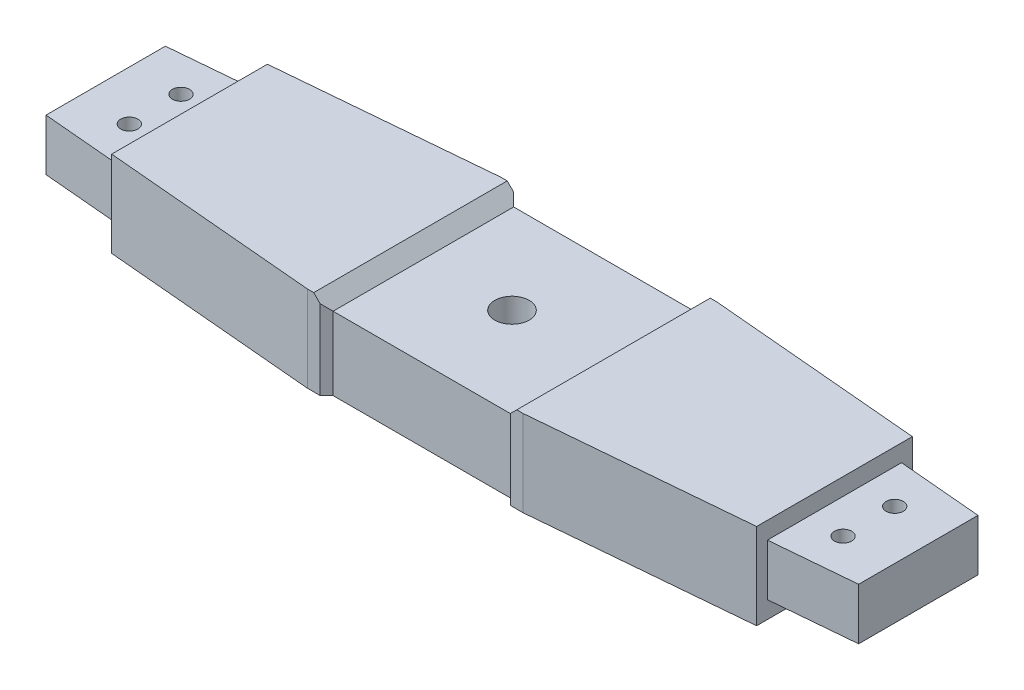
from build123d import *

# Parameters (mm, degrees)
SKETCH1_R                = 4
BOSS_EXTRUDE1_DEPTH      = 12
BOSS_EXTRUDE2_DEPTH      = 4
BOSS_EXTRUDE2_DEPTH_BACK = 16
SKETCH2_R                = 4
CUT_EXTRUDE1_DEPTH       = 107.329676008
CUT_EXTRUDE1_DEPTH_BACK  = 107.329676008
SKETCH6_R                = 2.05
CUT_EXTRUDE3_DEPTH       = 6.5
SKETCH7_R                = 2
CUT_EXTRUDE4_DEPTH       = 99.930531182
CUT_EXTRUDE5_DEPTH       = 100.65565714
CUT_EXTRUDE5_DEPTH_BACK  = 100.65565714
CUT_EXTRUDE6_DEPTH       = 99.930531182


with BuildPart() as part:
    # Sketch1 → Boss-Extrude1 (new body)
    with BuildSketch(Plane(origin=(0, 0, 0), x_dir=(1, 0, 0), z_dir=(0, 1, 0))):
        Polygon((25, 20), (-25, 20), (-95, 13.834935185), (-95, -13.834935185), (-25, -20), (25, -20), (95, -13.834935185), (95, 13.834935185), align=None)
        Circle(SKETCH1_R, mode=Mode.SUBTRACT)
    extrude(amount=BOSS_EXTRUDE1_DEPTH)

    # Sketch2 → Boss-Extrude2 (add, two sides: drawn at the far end of the back side and taken through both)
    with BuildSketch(Plane(origin=(0, 12, 0), x_dir=(1, 0, 0), z_dir=(0, 1, 0)).offset(-BOSS_EXTRUDE2_DEPTH_BACK)):
        Polygon((-25.109877781, 22.5), (-75, 18.10605947), (-75, -18.10605947), (-25.109877781, -22.5), (25.109877781, -22.5), (75, -18.10605947), (75, 18.10605947), (25.109877781, 22.5), align=None)
        Circle(SKETCH2_R, mode=Mode.SUBTRACT)
    extrude(amount=BOSS_EXTRUDE2_DEPTH + BOSS_EXTRUDE2_DEPTH_BACK)

    # Sketch3 → Cut-Extrude1 (cut, two sides: drawn at the far end of the back side and taken through both)
    with BuildSketch(Plane.XY.offset(22.5).offset(-CUT_EXTRUDE1_DEPTH_BACK)):
        Polygon((23.609877781, 16), (-23.609877781, 16), (-20.609877781, 13), (20.609877781, 13), align=None)
    extrude(amount=CUT_EXTRUDE1_DEPTH + CUT_EXTRUDE1_DEPTH_BACK, mode=Mode.SUBTRACT)

    # Sketch6 → Cut-Extrude3 (cut)
    with BuildSketch(Plane(origin=(0, 0, -22.5), x_dir=(-1, 0, 0), z_dir=(0, 0, -1))):
        with Locations((-10, 4.5)):
            Circle(SKETCH6_R)
        with Locations((10, 4.5)):
            Circle(SKETCH6_R)
    extrude(amount=-CUT_EXTRUDE3_DEPTH, mode=Mode.SUBTRACT)

    # Sketch7 → Cut-Extrude4 (cut, through all)
    with BuildSketch(Plane.XZ):
        with Locations((-83, -6)):
            Circle(SKETCH7_R)
        with Locations((-83, 6)):
            Circle(SKETCH7_R)
        with Locations((83, 6)):
            Circle(SKETCH7_R)
        with Locations((83, -6)):
            Circle(SKETCH7_R)
    extrude(amount=-CUT_EXTRUDE4_DEPTH, mode=Mode.SUBTRACT)

    # Sketch8 → Cut-Extrude5 (cut, two sides: drawn at the far end of the back side and taken through both)
    with BuildSketch(Plane.XZ.offset(4).offset(-CUT_EXTRUDE5_DEPTH_BACK)):
        Polygon((-22.109877781, -22.5), (-20.609877781, -21), (20.609877781, -21), (22.109877781, -22.5), align=None)
        Polygon((-22.109877781, 22.5), (22.109877781, 22.5), (20.609877781, 21), (-20.609877781, 21), align=None)
    extrude(amount=CUT_EXTRUDE5_DEPTH + CUT_EXTRUDE5_DEPTH_BACK, mode=Mode.SUBTRACT)

    # Sketch9 → Cut-Extrude6 (cut, through all)
    with BuildSketch(Plane(origin=(0, 12, 0), x_dir=(1, 0, 0), z_dir=(0, 1, 0))):
        Polygon((-94.5, 13.878971362), (-94.5, -13.878971362), (-95, -13.834935185), (-95, 13.834935185), align=None)
        Polygon((94.5, 13.878971362), (94.5, -13.878971362), (95, -13.834935185), (95, 13.834935185), align=None)
    extrude(amount=-CUT_EXTRUDE6_DEPTH, mode=Mode.SUBTRACT)


solid = part.part
